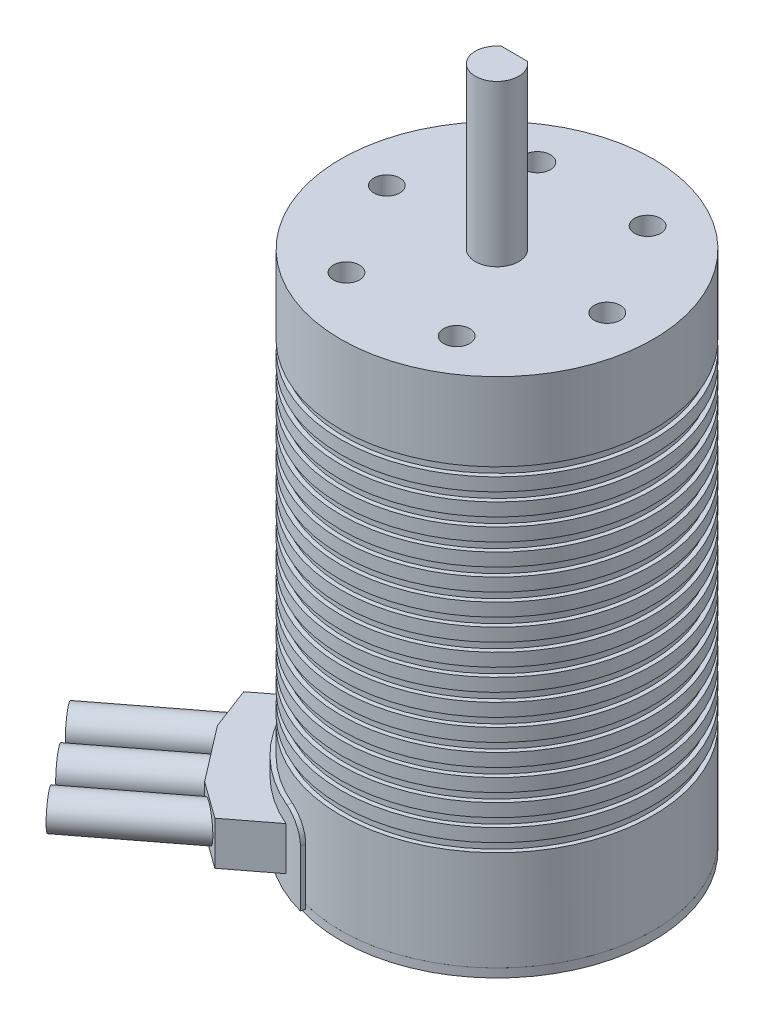
from build123d import *
from build123d.topology import SkipClean

# Parameters (mm, degrees)
SKETCH2_R           = 18
BOSS_EXTRUDE1_DEPTH = 60
SKETCH3_R           = 2.5
BOSS_EXTRUDE2_DEPTH = 3
BOSS_EXTRUDE3_DEPTH = 15.5
SKETCH8_R           = 1.5
CUT_EXTRUDE1_DEPTH  = 5.5
SKETCH9_W           = 0.5
SKETCH9_H           = 1
SKETCH10_R          = 18
CUT_EXTRUDE2_DEPTH  = 1
SKETCH11_R          = 18
BOSS_EXTRUDE4_DEPTH = 1
SKETCH12_W          = 0.5
SKETCH12_H          = 9
REVOLVE1_ANGLE      = 75
FILLET1_R           = 2.5
SKETCH14_W          = 9.219639875
SKETCH14_H          = 5
BOSS_EXTRUDE5_DEPTH = 9
CHAMFER1_SIZE       = 1.5
CHAMFER1_SIZE2      = 5
CHAMFER2_SIZE       = 5
CHAMFER2_SIZE2      = 1.5
SKETCH15_R          = 2
BOSS_EXTRUDE6_DEPTH = 12.5


with BuildPart() as part:
    # Sketch2 → Boss-Extrude1 (new body)
    with BuildSketch(Plane(origin=(0, 0, 0), x_dir=(1, 0, 0), z_dir=(0, 1, 0))):
        Circle(SKETCH2_R)
    extrude(amount=BOSS_EXTRUDE1_DEPTH)

    # Sketch8 → Cut-Extrude1 (cut)
    with BuildSketch(Plane(origin=(0, 60, 0), x_dir=(1, 0, 0), z_dir=(0, 1, 0))):
        with Locations((-12.7, 0)):
            Circle(SKETCH8_R)
        with Locations((-6.35, 10.998522628)):
            Circle(SKETCH8_R)
        with Locations((6.35, 10.998522628)):
            Circle(SKETCH8_R)
        with Locations((12.7, 0)):
            Circle(SKETCH8_R)
        with Locations((6.35, -10.998522628)):
            Circle(SKETCH8_R)
        with Locations((-6.35, -10.998522628)):
            Circle(SKETCH8_R)
    extrude(amount=-CUT_EXTRUDE1_DEPTH, mode=Mode.SUBTRACT)

    # Sketch9 → Cut-Revolve1 (revolve, cut)
    with BuildSketch(Plane.XY):
        with Locations((17.75, 50.5)):
            Rectangle(SKETCH9_W, SKETCH9_H)
        with Locations((17.75, 48)):
            Rectangle(SKETCH9_W, SKETCH9_H)
        with Locations((17.75, 45.5)):
            Rectangle(SKETCH9_W, SKETCH9_H)
        with Locations((17.75, 43)):
            Rectangle(SKETCH9_W, SKETCH9_H)
        with Locations((17.75, 40.5)):
            Rectangle(SKETCH9_W, SKETCH9_H)
        with Locations((17.75, 38)):
            Rectangle(SKETCH9_W, SKETCH9_H)
        with Locations((17.75, 35.5)):
            Rectangle(SKETCH9_W, SKETCH9_H)
        with Locations((17.75, 33)):
            Rectangle(SKETCH9_W, SKETCH9_H)
        with Locations((17.75, 30.5)):
            Rectangle(SKETCH9_W, SKETCH9_H)
        with Locations((17.75, 28)):
            Rectangle(SKETCH9_W, SKETCH9_H)
        with Locations((17.75, 25.5)):
            Rectangle(SKETCH9_W, SKETCH9_H)
        with Locations((17.75, 23)):
            Rectangle(SKETCH9_W, SKETCH9_H)
        with Locations((17.75, 20.5)):
            Rectangle(SKETCH9_W, SKETCH9_H)
        with Locations((17.75, 18)):
            Rectangle(SKETCH9_W, SKETCH9_H)
        with Locations((17.75, 15.5)):
            Rectangle(SKETCH9_W, SKETCH9_H)
        with Locations((17.75, 13)):
            Rectangle(SKETCH9_W, SKETCH9_H)
    revolve(axis=Axis((0, 0, 0), (0, 1, 0)), mode=Mode.SUBTRACT)

    # Sketch10 → Cut-Extrude2 (cut)
    with BuildSketch(Plane.XZ):
        Circle(SKETCH10_R)
    extrude(amount=-CUT_EXTRUDE2_DEPTH, mode=Mode.SUBTRACT)

    # Sketch12 → Revolve1 (revolve)
    with BuildSketch(Plane.XY):
        with Locations((-18.25, 5)):
            Rectangle(SKETCH12_W, SKETCH12_H)
    revolve(axis=Axis((0, 0, 0), (0, 1, 0)), revolution_arc=REVOLVE1_ANGLE)

    # Fillet1
    fillet1_edges = [part.edges().sort_by_distance(p)[0] for p in [
        (-4.723447573, 9.5, 17.62814633),
        (-18.25, 9.5, 0),
    ]]
    fillet(fillet1_edges, radius=FILLET1_R)

    # Sketch14 → Boss-Extrude5 (add, symmetric)
    with BuildSketch(Plane(origin=(0, 0, 0), x_dir=(0.7933533402912342, 0, -0.6087614290087221), z_dir=(0.608761429008722, 0, 0.793353340291234))):
        with Locations((-18.890180063, 5)):
            Rectangle(SKETCH14_W, SKETCH14_H)
    extrude(amount=BOSS_EXTRUDE5_DEPTH, both=True)

    # Chamfer1
    chamfer1_edges = [part.edges().sort_by_distance(p)[0] for p in [
        (-24.122656358, 5, 7.165713519),
    ]]
    chamfer1_side = [part.faces().sort_by_distance(p)[0] for p in [
        (-21.212330815, 5, 4.932542186),
    ]]
    chamfer(chamfer1_edges, length=CHAMFER1_SIZE, length2=CHAMFER1_SIZE2, reference=chamfer1_side[0])

    # Chamfer2
    chamfer2_edges = [part.edges().sort_by_distance(p)[0] for p in [
        (-13.164950636, 5, 21.446073644),
    ]]
    chamfer2_side = [part.faces().sort_by_distance(p)[0] for p in [
        (-17.121899924, 5, 16.289276932),
    ]]
    chamfer(chamfer2_edges, length=CHAMFER2_SIZE, length2=CHAMFER2_SIZE2, reference=chamfer2_side[0])

    # Sketch15 → Boss-Extrude6 (add, symmetric)
    with BuildSketch(Plane(origin=(-18.643803497, 0, 14.305893582), x_dir=(0.6087614290087222, 0, 0.793353340291234), z_dir=(-0.793353340291234, 0, 0.6087614290087222))):
        with Locations((0, 5)):
            Circle(SKETCH15_R)
        with Locations((6, 5)):
            Circle(SKETCH15_R)
        with Locations((-6, 5)):
            Circle(SKETCH15_R)
    extrude(amount=BOSS_EXTRUDE6_DEPTH, both=True)


with BuildPart() as body_2:
    # Sketch3 → Boss-Extrude2 (new body)
    with BuildSketch(Plane(origin=(0, 60, 0), x_dir=(1, 0, 0), z_dir=(0, 1, 0))):
        Circle(SKETCH3_R)
    extrude(amount=BOSS_EXTRUDE2_DEPTH)

    # Sketch4 → Boss-Extrude3 (add)
    with SkipClean():  # the faces are left unmerged after this step: merging them gives an invalid solid
        with BuildSketch(Plane(origin=(0, 63, 0), x_dir=(1, 0, 0), z_dir=(0, 1, 0))):
            with BuildLine():
                Line((-1.5, 2), (1.5, 2))
                ThreePointArc((1.5, 2), (0, -2.5), (-1.5, 2))
            make_face()
        extrude(amount=BOSS_EXTRUDE3_DEPTH)
    add(body_2.part.scale(1), mode=Mode.REPLACE)  # the faces are merged on a copy


with BuildPart() as body_3:
    # Sketch11 → Boss-Extrude4 (new body)
    with BuildSketch(Plane.XZ.offset(-1)):
        Circle(SKETCH11_R)
    extrude(amount=BOSS_EXTRUDE4_DEPTH)


solid = Compound([part.part, body_2.part, body_3.part])
